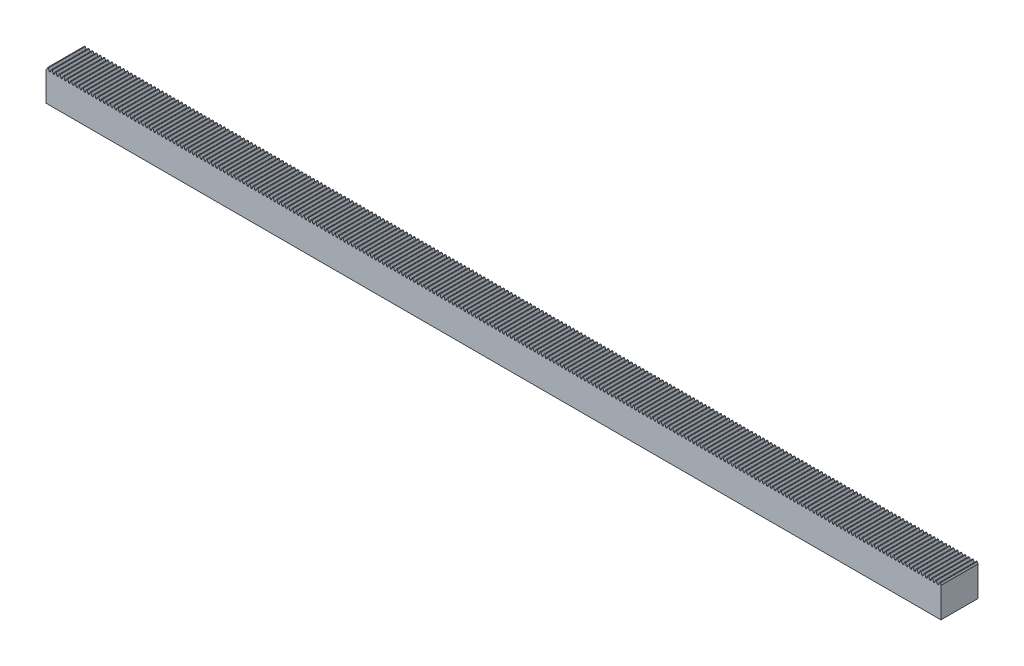
from build123d import *

# Parameters (mm, degrees)
BLANKSKE_W        = 1450
BLANKSKE_H        = 51.4
BLANK_DEPTH       = 60
TOOTHCUTSIM_DEPTH = 1453.150804841
TEETHCUTS_COUNT   = 232
TEETHCUTS_PITCH   = 6.2831853


with BuildPart() as part:
    # BlankSke → Blank (new body)
    with BuildSketch(Plane.XY):
        with Locations((725, 25.7)):
            Rectangle(BLANKSKE_W, BLANKSKE_H)
    extrude(amount=-BLANK_DEPTH)

    # TooCutSkeSim → ToothCutSim (cut, through all)
    with BuildSketch(Plane.XY):
        Polygon((0.861870739, 46.9), (-0.861870739, 46.9), (-2.508981637, 51.4254), (2.508981637, 51.4254), align=None)
    toothcutsim = extrude(amount=-TOOTHCUTSIM_DEPTH, mode=Mode.SUBTRACT)

    # TeethCuts: ToothCutSim ×232
    with Locations(*[(i * TEETHCUTS_PITCH, 0, 0) for i in range(1, TEETHCUTS_COUNT)]):
        add(toothcutsim, mode=Mode.SUBTRACT)


solid = part.part
